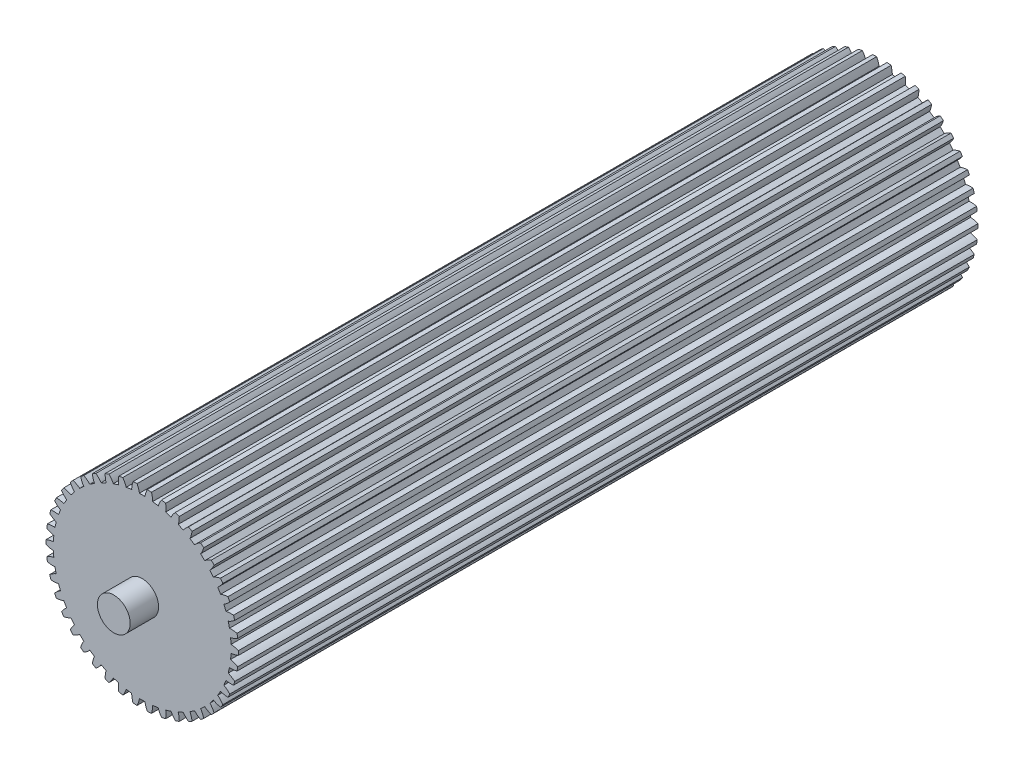
from build123d import *

# Parameters (mm, degrees)
SKETCH1_R           = 18.626666667
BOSS_EXTRUDE1_DEPTH = 143.2
CUT_EXTRUDE2_DEPTH  = 144.2
CIRPATTERN1_COUNT   = 42
SKETCH3_R           = 3.175
BOSS_EXTRUDE2_DEPTH = 8
BOSS_EXTRUDE3_START = 148.7
SKETCH4_R           = 3.175
BOSS_EXTRUDE3_DEPTH = 5.5


with BuildPart() as part:
    # Sketch1 → Boss-Extrude1 (new body)
    with BuildSketch(Plane.XY):
        Circle(SKETCH1_R)
    extrude(amount=BOSS_EXTRUDE1_DEPTH)

    # Sketch2 → Cut-Extrude2 (cut, symmetric)
    with BuildSketch(Plane.XY):
        with BuildLine():
            add(Edge.make_bspline(
                [(17.197794317, 0.739009432), (17.203892696, 0.739218074), (17.21543595, 0.73930356), (17.234290481, 0.73910886), (17.271535049, 0.737867759), (17.313692039, 0.735293434), (17.361379443, 0.731228124), (17.412709302, 0.725698856), (17.45664549, 0.720250412), (17.500520881, 0.714143297), (17.54427023, 0.70745302), (17.597315869, 0.698630803), (17.66099398, 0.687053386), (17.735530693, 0.672062459), (17.820194333, 0.653336786), (17.906624473, 0.632403089), (17.991790805, 0.610283496), (18.077983339, 0.586179627), (18.161481204, 0.561614407), (18.248366585, 0.534292881), (18.328644137, 0.508156476), (18.418766174, 0.476867684), (18.491547283, 0.451032541), (18.566887923, 0.422665763), (18.603580461, 0.408611376), (18.622342766, 0.401324063)],
                knots=[0, 0, 0, 0, 0, 0.015083688, 0.02853182, 0.04661014, 0.092110526, 0.119476176, 0.146842496, 0.174208854, 0.201574956, 0.228941013, 0.256307345, 0.307035032, 0.361767352, 0.416499661, 0.471231937, 0.525964282, 0.580696616, 0.635428982, 0.690161387, 0.744893688, 0.799626082, 0.854358407, 0.909090914, 0.909090914, 0.909090914, 0.909090914, 0.909090914], degree=4))
            Line((18.622342766, 0.401324063), (59.986071903, 1.29274036))
            add(Edge.make_bspline(
                [(59.986071903, 1.29274036), (59.984705998, 1.356121459), (59.981788512, 1.47956213), (59.973929675, 1.790524821), (59.96571531, 2.028377944), (59.95367575, 2.372260269), (59.94146295, 2.652288961), (59.926888549, 2.970752343), (59.911256555, 3.265919581), (59.893811207, 3.574911958), (59.874955933, 3.875648951), (59.85453816, 4.180793709), (59.83250074, 4.483826067), (59.809127391, 4.786758311), (59.783837648, 5.091537965), (59.757659801, 5.391726207), (59.728857375, 5.699867489), (59.700322379, 5.99406778), (59.667269491, 6.311146391), (59.637609774, 6.589867618), (59.598261861, 6.931703464), (59.570934309, 7.168124252), (59.532358786, 7.476785046), (59.516845808, 7.599281815), (59.508749995, 7.662158578)],
                knots=[0.083333333, 0.083333333, 0.083333333, 0.083333333, 0.083333333, 0.123015873, 0.162698413, 0.202380952, 0.242063492, 0.281746032, 0.321428571, 0.361111111, 0.400793651, 0.44047619, 0.48015873, 0.51984127, 0.55952381, 0.599206349, 0.638888889, 0.678571429, 0.718253968, 0.757936508, 0.797619048, 0.837301587, 0.876984127, 0.916666667, 0.916666667, 0.916666667, 0.916666667, 0.916666667], degree=4))
            Line((59.508749995, 7.662158578), (18.474160832, 2.378674563))
            add(Edge.make_bspline(
                [(17.115852804, 1.832442931), (17.121914166, 1.833145535), (17.133341232, 1.834781437), (17.151956155, 1.837784085), (17.188599755, 1.844562338), (17.229902204, 1.853391084), (17.276451075, 1.864518426), (17.326383528, 1.877636255), (17.369016937, 1.889572194), (17.411492058, 1.902150385), (17.453755628, 1.915286439), (17.504893908, 1.931916162), (17.566135263, 1.952854998), (17.63760518, 1.978787609), (17.718532281, 2.009922593), (17.800877062, 2.043504222), (17.881795402, 2.07807014), (17.963432742, 2.11475112), (18.042336749, 2.151486678), (18.124179629, 2.191452639), (18.199665119, 2.22926187), (18.284117214, 2.273633185), (18.35223489, 2.310027232), (18.422506189, 2.349306116), (18.456694203, 2.368672266), (18.474160832, 2.378674563)],
                knots=[0, 0, 0, 0, 0, 0.015083688, 0.02853182, 0.04661014, 0.092110526, 0.119476176, 0.146842496, 0.174208854, 0.201574956, 0.228941013, 0.256307345, 0.307035032, 0.361767352, 0.416499661, 0.471231937, 0.525964282, 0.580696616, 0.635428982, 0.690161387, 0.744893688, 0.799626082, 0.854358407, 0.909090914, 0.909090914, 0.909090914, 0.909090914, 0.909090914], degree=4))
            Line((17.115852804, 1.832442931), (17.197794317, 0.739009432))
        make_face()
    cut_extrude2 = extrude(amount=CUT_EXTRUDE2_DEPTH, both=True, mode=Mode.SUBTRACT)

    # CirPattern1: Cut-Extrude2 ×42 about axis
    cirpattern1_axis = Axis((0, 0, -15.835), (0, 0, 1))
    for i in range(1, CIRPATTERN1_COUNT):
        add(cut_extrude2.rotate(cirpattern1_axis, i * 360 / CIRPATTERN1_COUNT), mode=Mode.SUBTRACT)

    # Sketch3 → Boss-Extrude2 (add)
    with BuildSketch(Plane.XY):
        Circle(SKETCH3_R)
    extrude(amount=-BOSS_EXTRUDE2_DEPTH)

    # Sketch4 → Boss-Extrude3 (add)
    with BuildSketch(Plane.XY.offset(BOSS_EXTRUDE3_START)):
        Circle(SKETCH4_R)
    extrude(amount=-BOSS_EXTRUDE3_DEPTH)


solid = part.part
